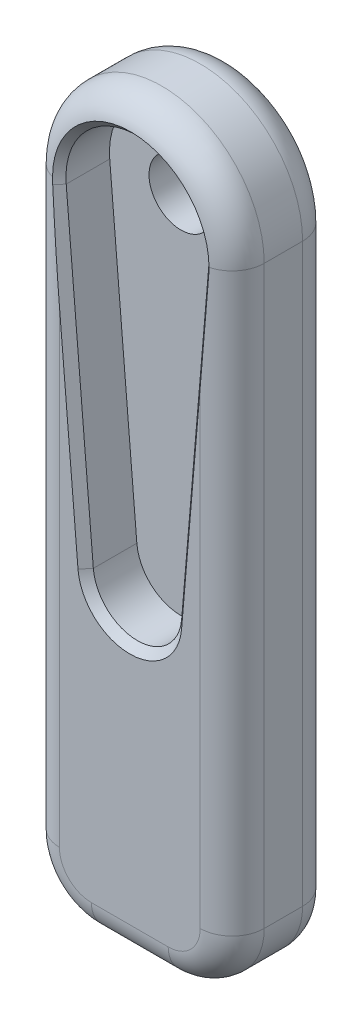
from build123d import *

# Parameters (mm, degrees)
BOSS_EXTRUDE1_DEPTH = 2.54
BOSS_EXTRUDE2_START = -2.54
SKETCH1_3_R         = 1.5875
BOSS_EXTRUDE2_DEPTH = 2.54
CHAMFER1_SIZE       = 0.381
FILLET1_R           = 1.5875


with BuildPart() as part:
    # Sketch1 → Boss-Extrude1 (new body)
    with BuildSketch(Plane.XY):
        with BuildLine():
            Line((5.08, -28.575), (5.08, 0))
            ThreePointArc((5.08, 0), (0, 5.08), (-5.08, 0))
            Line((-5.08, 0), (-5.08, -28.575))
            ThreePointArc((-5.08, -28.575), (-4.15006403, -30.82006403), (-1.905, -31.75))
            Line((-1.905, -31.75), (1.905, -31.75))
            ThreePointArc((1.905, -31.75), (4.15006403, -30.82006403), (5.08, -28.575))
        make_face()
        with BuildLine():
            Line((-3.535704427, -0.30033797), (-2.190548714, -16.136074647))
            ThreePointArc((-2.190548714, -16.136074647), (-1.487288465, -17.568981304), (0, -18.1484375))
            ThreePointArc((0, -18.1484375), (1.487288465, -17.568981304), (2.190548714, -16.136074647))
            Line((2.190548714, -16.136074647), (3.535704427, -0.30033797))
            ThreePointArc((3.535704427, -0.30033797), (0, 3.5484375), (-3.535704427, -0.30033797))
        make_face(mode=Mode.SUBTRACT)
    extrude(amount=BOSS_EXTRUDE1_DEPTH)

    # Sketch1<3> → Boss-Extrude2 (add)
    with BuildSketch(Plane.XY.offset(BOSS_EXTRUDE2_START)):
        with BuildLine():
            ThreePointArc((1.905, -31.75), (4.15006403, -30.82006403), (5.08, -28.575))
            Line((5.08, -28.575), (5.08, 0))
            ThreePointArc((5.08, 0), (0, 5.08), (-5.08, 0))
            Line((-5.08, 0), (-5.08, -28.575))
            ThreePointArc((-5.08, -28.575), (-4.15006403, -30.82006403), (-1.905, -31.75))
            Line((-1.905, -31.75), (1.905, -31.75))
        make_face()
        Circle(SKETCH1_3_R, mode=Mode.SUBTRACT)
    extrude(amount=BOSS_EXTRUDE2_DEPTH)

    # Chamfer1
    chamfer1_edges = [part.edges().sort_by_distance(p)[0] for p in [
        (0, 3.5484375, 2.54),
        (2.86312657, -8.218206309, 2.54),
        (0, -18.1484375, 2.54),
        (-2.86312657, -8.218206309, 2.54),
    ]]
    chamfer(chamfer1_edges, length=CHAMFER1_SIZE)

    # Fillet1
    # the kernel refuses this fillet: 1.5875 mm, written as the material it takes off along each edge
    with BuildSketch(Plane(origin=(1.905, -28.575, 2.54), x_dir=(0, -1, 0), z_dir=(-1, 0, 0))) as fillet1_piece_1:
        with BuildLine():
            CenterArc((3.175 - FILLET1_R, -FILLET1_R), FILLET1_R, 0, 90)
            Line((3.175, -FILLET1_R), (3.175, 0))
            Line((3.175, 0), (3.175 - FILLET1_R, 0))
        make_face()
    revolve(axis=Axis((1.905, -28.575, 2.54), (0, 0, 1)), revolution_arc=90, mode=Mode.SUBTRACT)
    with BuildSketch(Plane(origin=(-1.905, -28.575, 2.54), x_dir=(-1, 0, 0), z_dir=(0, 1, 0))) as fillet1_piece_2:
        with BuildLine():
            CenterArc((3.175 - FILLET1_R, -FILLET1_R), FILLET1_R, 0, 90)
            Line((3.175, -FILLET1_R), (3.175, 0))
            Line((3.175, 0), (3.175 - FILLET1_R, 0))
        make_face()
    revolve(axis=Axis((-1.905, -28.575, 2.54), (0, 0, 1)), revolution_arc=90, mode=Mode.SUBTRACT)
    with BuildSketch(Plane(origin=(-5.08, 0, 2.54), x_dir=(1, 0, 0), z_dir=(0, -1, 0)), Plane(origin=(-5.08, 0, -2.54), x_dir=(0, 0, 1), z_dir=(0, -1, 0)), Plane(origin=(5.08, -28.575, 2.54), x_dir=(-1, 0, 0), z_dir=(0, 1, 0)), Plane(origin=(5.08, -28.575, -2.54), x_dir=(0, 0, 1), z_dir=(0, 1, 0))) as fillet1_piece_3:
        with BuildLine():
            CenterArc((FILLET1_R, -FILLET1_R), FILLET1_R, 90, 90)
            Line((0, -FILLET1_R), (0, 0))
            Line((0, 0), (FILLET1_R, 0))
        make_face()
    extrude(amount=28.575, mode=Mode.SUBTRACT)
    with BuildSketch(Plane(origin=(1.905, -28.575, -2.54), x_dir=(0, -1, 0), z_dir=(-1, 0, 0))) as fillet1_piece_4:
        with BuildLine():
            CenterArc((3.175 - FILLET1_R, FILLET1_R), FILLET1_R, 270, 90)
            Line((3.175 - FILLET1_R, 0), (3.175, 0))
            Line((3.175, 0), (3.175, FILLET1_R))
        make_face()
    revolve(axis=Axis((1.905, -28.575, -2.54), (0, 0, 1)), revolution_arc=90, mode=Mode.SUBTRACT)
    with BuildSketch(Plane(origin=(-1.905, -28.575, -2.54), x_dir=(-1, 0, 0), z_dir=(0, 1, 0))) as fillet1_piece_5:
        with BuildLine():
            CenterArc((3.175 - FILLET1_R, FILLET1_R), FILLET1_R, 270, 90)
            Line((3.175 - FILLET1_R, 0), (3.175, 0))
            Line((3.175, 0), (3.175, FILLET1_R))
        make_face()
    revolve(axis=Axis((-1.905, -28.575, -2.54), (0, 0, 1)), revolution_arc=90, mode=Mode.SUBTRACT)
    with BuildSketch(Plane(origin=(0, 0, -2.54), x_dir=(1, 0, 0), z_dir=(0, -1, 0))) as fillet1_piece_6:
        with BuildLine():
            CenterArc((5.08 - FILLET1_R, FILLET1_R), FILLET1_R, 270, 90)
            Line((5.08 - FILLET1_R, 0), (5.08, 0))
            Line((5.08, 0), (5.08, FILLET1_R))
        make_face()
    revolve(axis=Axis((0, 0, -2.54), (0, 0, 1)), revolution_arc=180, mode=Mode.SUBTRACT)
    with BuildSketch(Plane(origin=(0, 0, 2.54), x_dir=(1, 0, 0), z_dir=(0, -1, 0))) as fillet1_piece_7:
        with BuildLine():
            CenterArc((5.08 - FILLET1_R, -FILLET1_R), FILLET1_R, 0, 90)
            Line((5.08, -FILLET1_R), (5.08, 0))
            Line((5.08, 0), (5.08 - FILLET1_R, 0))
        make_face()
    revolve(axis=Axis((0, 0, 2.54), (0, 0, 1)), revolution_arc=180, mode=Mode.SUBTRACT)
    with BuildSketch(Plane(origin=(-1.905, -31.75, 2.54), x_dir=(0, 1, 0), z_dir=(1, 0, 0)), Plane(origin=(-1.905, -31.75, -2.54), x_dir=(0, 0, 1), z_dir=(1, 0, 0))) as fillet1_piece_8:
        with BuildLine():
            CenterArc((FILLET1_R, -FILLET1_R), FILLET1_R, 90, 90)
            Line((0, -FILLET1_R), (0, 0))
            Line((0, 0), (FILLET1_R, 0))
        make_face()
    extrude(amount=3.81, mode=Mode.SUBTRACT)


solid = part.part
